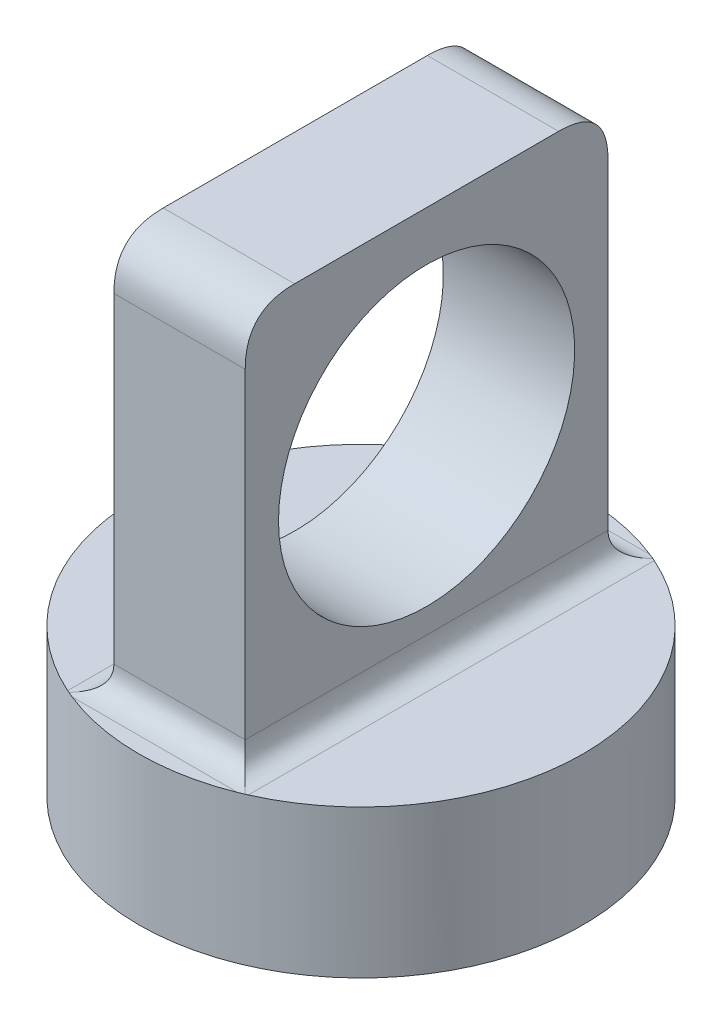
from build123d import *

# Parameters (mm, degrees)
SKETCH1_R           = 114.3
BOSS_EXTRUDE1_DEPTH = 76.2
SKETCH3_W           = 67.564
SKETCH3_H           = 186.69
BOSS_EXTRUDE3_DEPTH = 203.2
SKETCH4_R           = 76.2
CUT_EXTRUDE1_DEPTH  = 127
FILLET1_SIZE        = 25.4
FILLET2_SIZE        = 12.7
SKETCH2_R           = 88.9
CUT_EXTRUDE2_DEPTH  = 38.1


with BuildPart() as part:
    # Sketch1 → Boss-Extrude1 (new body)
    with BuildSketch(Plane(origin=(0, 0, 0), x_dir=(1, 0, 0), z_dir=(0, 1, 0))):
        with Locations(Location((0, 0, 0), (0, 0, 90))):
            Circle(SKETCH1_R)
    extrude(amount=BOSS_EXTRUDE1_DEPTH)

    # Sketch3 → Boss-Extrude3 (add)
    with BuildSketch(Plane(origin=(0, 76.2, 0), x_dir=(1, 0, 0), z_dir=(0, 1, 0))):
        with Locations((-0.02614759, 0)):
            Rectangle(SKETCH3_W, SKETCH3_H)
    extrude(amount=BOSS_EXTRUDE3_DEPTH)

    # Sketch4 → Cut-Extrude1 (cut)
    with BuildSketch(Plane.ZY.offset(33.80814759)):
        with Locations((0, 177.8)):
            Circle(SKETCH4_R)
    extrude(amount=-CUT_EXTRUDE1_DEPTH, mode=Mode.SUBTRACT)

    # Fillet1
    # a fillet whose section is not a circle: 25.4 mm, written as the material it takes off along each edge
    with BuildSketch(Plane(origin=(97.25585241, 279.4, 93.345), x_dir=(0, -1, 0), z_dir=(-1, 0, 0)), Plane(origin=(-97.30814759, 279.4, -93.345), x_dir=(0, -1, 0), z_dir=(1, 0, 0))) as fillet1_piece_1:
        with BuildLine():
            Bezier((FILLET1_SIZE, 0), (0, 0), (0, -FILLET1_SIZE), weights=[1, 1, 1])
            Line((0, -FILLET1_SIZE), (0, 0))
            Line((0, 0), (FILLET1_SIZE, 0))
        make_face()
    extrude(amount=194.564, mode=Mode.SUBTRACT)

    # Fillet2
    # a fillet whose section is not a circle: 12.7 mm, written as the material it adds along each edge
    with BuildSketch(Plane(origin=(33.75585241, 76.2, 93.345), x_dir=(0, 0, 1), z_dir=(-1, 0, 0)), Plane(origin=(-33.80814759, 76.2, -93.345), x_dir=(0, 0, -1), z_dir=(1, 0, 0))) as fillet2_piece_1:
        with BuildLine():
            Bezier((FILLET2_SIZE, 0), (0, 0), (0, FILLET2_SIZE), weights=[1, 1, 1])
            Line((0, FILLET2_SIZE), (0, 0))
            Line((0, 0), (FILLET2_SIZE, 0))
        make_face()
    extrude(amount=67.564)
    with BuildSketch(Plane(origin=(-33.80814759, 76.2, 93.345), x_dir=(-1, 0, 0), z_dir=(0, 0, -1)), Plane(origin=(33.75585241, 76.2, -93.345), x_dir=(1, 0, 0), z_dir=(0, 0, 1))) as fillet2_piece_2:
        with BuildLine():
            Bezier((FILLET2_SIZE, 0), (0, 0), (0, FILLET2_SIZE), weights=[1, 1, 1])
            Line((0, FILLET2_SIZE), (0, 0))
            Line((0, 0), (FILLET2_SIZE, 0))
        make_face()
    extrude(amount=186.69)
    with BuildSketch(Plane(origin=(65.50585241, 76.2, 93.345), x_dir=(0, 0, 1), z_dir=(-1, 0, 0))) as fillet2_piece_3a_section:
        with BuildLine():
            Bezier((FILLET2_SIZE, 0), (0, 0), (0, FILLET2_SIZE), weights=[1, 1, 1])
            Line((0, FILLET2_SIZE), (0, 0))
            Line((0, 0), (FILLET2_SIZE, 0))
        make_face()
    fillet2_piece_3a = extrude(amount=99.314, mode=Mode.PRIVATE)
    fillet2_piece_3a = fillet2_piece_3a & Plane(origin=(0, 76.2, 0), x_dir=(0, 0, -1), z_dir=(0, -1, 0)) * Cylinder(114.3, 250, mode=Mode.PRIVATE)
    fillet2_piece_3a = split(fillet2_piece_3a, bisect_by=Plane(origin=(33.75585241, 76.2, 93.345), z_dir=(1, 0, 0)), keep=Keep.TOP, mode=Mode.PRIVATE)
    with BuildSketch(Plane(origin=(33.75585241, 76.2, -93.345), x_dir=(1, 0, 0), z_dir=(0, 0, 1))) as fillet2_piece_3b_section:
        with BuildLine():
            Bezier((FILLET2_SIZE, 0), (0, 0), (0, FILLET2_SIZE), weights=[1, 1, 1])
            Line((0, FILLET2_SIZE), (0, 0))
            Line((0, 0), (FILLET2_SIZE, 0))
        make_face()
    fillet2_piece_3b = extrude(amount=218.44, mode=Mode.PRIVATE)
    fillet2_piece_3b = fillet2_piece_3b & Plane(origin=(0, 76.2, 0), x_dir=(0, 0, -1), z_dir=(0, -1, 0)) * Cylinder(114.3, 488, mode=Mode.PRIVATE)
    fillet2_piece_3b = split(fillet2_piece_3b, bisect_by=Plane(origin=(33.75585241, 76.2, 93.345), z_dir=(0, 0, 1)), keep=Keep.TOP, mode=Mode.PRIVATE)
    fillet2_piece_3 = fillet2_piece_3a & fillet2_piece_3b
    add(fillet2_piece_3)
    with BuildSketch(Plane(origin=(-33.80814759, 76.2, 125.095), x_dir=(-1, 0, 0), z_dir=(0, 0, -1))) as fillet2_piece_4a_section:
        with BuildLine():
            Bezier((FILLET2_SIZE, 0), (0, 0), (0, FILLET2_SIZE), weights=[1, 1, 1])
            Line((0, FILLET2_SIZE), (0, 0))
            Line((0, 0), (FILLET2_SIZE, 0))
        make_face()
    fillet2_piece_4a = extrude(amount=218.44, mode=Mode.PRIVATE)
    fillet2_piece_4a = fillet2_piece_4a & Plane(origin=(0, 76.2, 0), x_dir=(0, 0, -1), z_dir=(0, -1, 0)) * Cylinder(114.3, 488, mode=Mode.PRIVATE)
    fillet2_piece_4a = split(fillet2_piece_4a, bisect_by=Plane(origin=(-33.80814759, 76.2, 93.345), z_dir=(0, 0, 1)), keep=Keep.TOP, mode=Mode.PRIVATE)
    with BuildSketch(Plane(origin=(33.75585241, 76.2, 93.345), x_dir=(0, 0, 1), z_dir=(-1, 0, 0))) as fillet2_piece_4b_section:
        with BuildLine():
            Bezier((FILLET2_SIZE, 0), (0, 0), (0, FILLET2_SIZE), weights=[1, 1, 1])
            Line((0, FILLET2_SIZE), (0, 0))
            Line((0, 0), (FILLET2_SIZE, 0))
        make_face()
    fillet2_piece_4b = extrude(amount=99.314, mode=Mode.PRIVATE)
    fillet2_piece_4b = fillet2_piece_4b & Plane(origin=(0, 76.2, 0), x_dir=(0, 0, -1), z_dir=(0, -1, 0)) * Cylinder(114.3, 250, mode=Mode.PRIVATE)
    fillet2_piece_4b = split(fillet2_piece_4b, bisect_by=Plane(origin=(-33.80814759, 76.2, 93.345), z_dir=(-1, 0, 0)), keep=Keep.TOP, mode=Mode.PRIVATE)
    fillet2_piece_4 = fillet2_piece_4a & fillet2_piece_4b
    add(fillet2_piece_4)
    with BuildSketch(Plane(origin=(-33.80814759, 76.2, 93.345), x_dir=(-1, 0, 0), z_dir=(0, 0, -1))) as fillet2_piece_5a_section:
        with BuildLine():
            Bezier((FILLET2_SIZE, 0), (0, 0), (0, FILLET2_SIZE), weights=[1, 1, 1])
            Line((0, FILLET2_SIZE), (0, 0))
            Line((0, 0), (FILLET2_SIZE, 0))
        make_face()
    fillet2_piece_5a = extrude(amount=218.44, mode=Mode.PRIVATE)
    fillet2_piece_5a = fillet2_piece_5a & Plane(origin=(0, 76.2, 0), x_dir=(0, 0, -1), z_dir=(0, -1, 0)) * Cylinder(114.3, 488, mode=Mode.PRIVATE)
    fillet2_piece_5a = split(fillet2_piece_5a, bisect_by=Plane(origin=(-33.80814759, 76.2, -93.345), z_dir=(0, 0, -1)), keep=Keep.TOP, mode=Mode.PRIVATE)
    with BuildSketch(Plane(origin=(-65.55814759, 76.2, -93.345), x_dir=(0, 0, -1), z_dir=(1, 0, 0))) as fillet2_piece_5b_section:
        with BuildLine():
            Bezier((FILLET2_SIZE, 0), (0, 0), (0, FILLET2_SIZE), weights=[1, 1, 1])
            Line((0, FILLET2_SIZE), (0, 0))
            Line((0, 0), (FILLET2_SIZE, 0))
        make_face()
    fillet2_piece_5b = extrude(amount=99.314, mode=Mode.PRIVATE)
    fillet2_piece_5b = fillet2_piece_5b & Plane(origin=(0, 76.2, 0), x_dir=(0, 0, -1), z_dir=(0, -1, 0)) * Cylinder(114.3, 250, mode=Mode.PRIVATE)
    fillet2_piece_5b = split(fillet2_piece_5b, bisect_by=Plane(origin=(-33.80814759, 76.2, -93.345), z_dir=(-1, 0, 0)), keep=Keep.TOP, mode=Mode.PRIVATE)
    fillet2_piece_5 = fillet2_piece_5a & fillet2_piece_5b
    add(fillet2_piece_5)
    with BuildSketch(Plane(origin=(33.75585241, 76.2, -125.095), x_dir=(1, 0, 0), z_dir=(0, 0, 1))) as fillet2_piece_6a_section:
        with BuildLine():
            Bezier((FILLET2_SIZE, 0), (0, 0), (0, FILLET2_SIZE), weights=[1, 1, 1])
            Line((0, FILLET2_SIZE), (0, 0))
            Line((0, 0), (FILLET2_SIZE, 0))
        make_face()
    fillet2_piece_6a = extrude(amount=218.44, mode=Mode.PRIVATE)
    fillet2_piece_6a = fillet2_piece_6a & Plane(origin=(0, 76.2, 0), x_dir=(0, 0, -1), z_dir=(0, -1, 0)) * Cylinder(114.3, 488, mode=Mode.PRIVATE)
    fillet2_piece_6a = split(fillet2_piece_6a, bisect_by=Plane(origin=(33.75585241, 76.2, -93.345), z_dir=(0, 0, -1)), keep=Keep.TOP, mode=Mode.PRIVATE)
    with BuildSketch(Plane(origin=(-33.80814759, 76.2, -93.345), x_dir=(0, 0, -1), z_dir=(1, 0, 0))) as fillet2_piece_6b_section:
        with BuildLine():
            Bezier((FILLET2_SIZE, 0), (0, 0), (0, FILLET2_SIZE), weights=[1, 1, 1])
            Line((0, FILLET2_SIZE), (0, 0))
            Line((0, 0), (FILLET2_SIZE, 0))
        make_face()
    fillet2_piece_6b = extrude(amount=99.314, mode=Mode.PRIVATE)
    fillet2_piece_6b = fillet2_piece_6b & Plane(origin=(0, 76.2, 0), x_dir=(0, 0, -1), z_dir=(0, -1, 0)) * Cylinder(114.3, 250, mode=Mode.PRIVATE)
    fillet2_piece_6b = split(fillet2_piece_6b, bisect_by=Plane(origin=(33.75585241, 76.2, -93.345), z_dir=(1, 0, 0)), keep=Keep.TOP, mode=Mode.PRIVATE)
    fillet2_piece_6 = fillet2_piece_6a & fillet2_piece_6b
    add(fillet2_piece_6)

    # Sketch2 → Cut-Extrude2 (cut)
    with BuildSketch(Plane(origin=(0, 0, 0), x_dir=(-1, 0, 0), z_dir=(0, -1, 0))):
        with Locations(Location((0, 0, 0), (0, 0, 90))):
            Circle(SKETCH2_R)
    extrude(amount=-CUT_EXTRUDE2_DEPTH, mode=Mode.SUBTRACT)


solid = part.part
